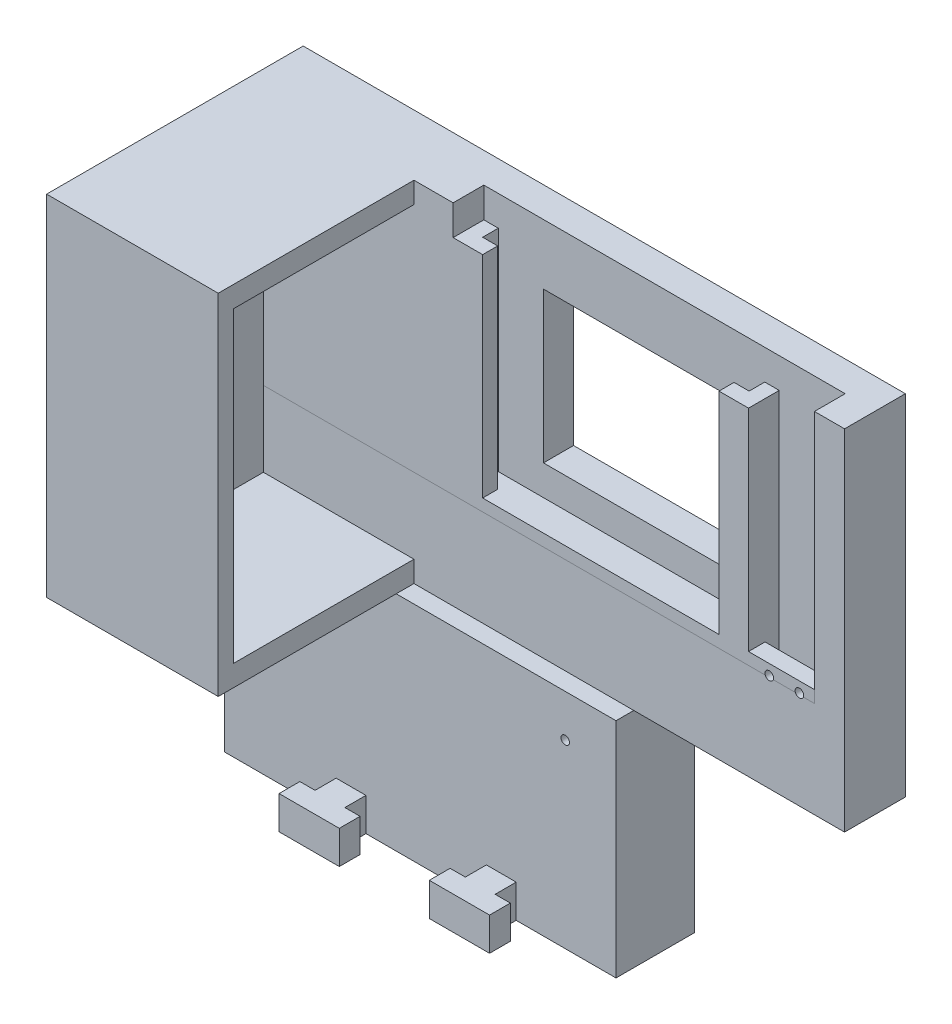
from build123d import *

# Parameters (mm, degrees)
SKETCH1_W            = 190
SKETCH1_H            = 80
BOSS_EXTRUDE1_DEPTH  = 10
BOSS_EXTRUDE2_DEPTH  = 70
SKETCH3_W            = 58.5
SKETCH3_H            = 50
CUT_EXTRUDE1_DEPTH   = 10
SKETCH5_W            = 190
SKETCH5_H            = 20.2
BOSS_EXTRUDE3_DEPTH  = 4
BOSS_EXTRUDE5_DEPTH  = 20.1999
SKETCH7_W            = 200
SKETCH7_H            = 74
SKETCH7_W_2          = 0.268020534
SKETCH7_H_2          = 19.603817147
BOSS_EXTRUDE6_DEPTH  = 5.9
BOSS_EXTRUDE7_DEPTH  = 11
SKETCH21_W           = 21.9
SKETCH21_H           = 4.7
CUT_EXTRUDE7_DEPTH   = 5.5
SKETCH22_R           = 1.425
CUT_EXTRUDE8_DEPTH   = 5.5
SKETCH23_W           = 70
SKETCH23_H           = 80
BOSS_EXTRUDE8_DEPTH  = 10.2
SKETCH24_W           = 70
SKETCH24_H           = 74
CUT_EXTRUDE9_DEPTH   = 185.949195132
BOSS_EXTRUDE10_DEPTH = 60
SKETCH26_W           = 57
SKETCH26_H           = 116
BOSS_EXTRUDE11_DEPTH = 5
SKETCH27_R           = 1.4
CUT_EXTRUDE10_DEPTH  = 10
SKETCH28_R           = 1.4
CUT_EXTRUDE11_DEPTH  = 10


with BuildPart() as part:
    # Sketch1 → Boss-Extrude1 (new body)
    with BuildSketch(Plane.XY):
        Rectangle(SKETCH1_W, SKETCH1_H)
    extrude(amount=BOSS_EXTRUDE1_DEPTH)

    # Sketch2 → Boss-Extrude2 (add)
    with BuildSketch(Plane.XZ.offset(40)):
        Polygon((-25, 10), (-20.2, 10), (-20.2, 15.2), (-15.2, 15.2), (-15.2, 20.2), (-25, 20.2), align=None)
        Polygon((68.3, 10), (73.1, 10), (73.1, 20.2), (63.3, 20.2), (63.3, 15.2), (68.3, 15.2), align=None)
    extrude(amount=-BOSS_EXTRUDE2_DEPTH)

    # Sketch3 → Cut-Extrude1 (cut)
    with BuildSketch(Plane.XY.offset(10)):
        with Locations((24.05, -5)):
            Rectangle(SKETCH3_W, SKETCH3_H)
    extrude(amount=-CUT_EXTRUDE1_DEPTH, mode=Mode.SUBTRACT)

    # Sketch5 → Boss-Extrude3 (add)
    with BuildSketch(Plane(origin=(0, -40, 0), x_dir=(-1, 0, 0), z_dir=(0, -1, 0))):
        with Locations((0, -10.1)):
            Rectangle(SKETCH5_W, SKETCH5_H)
    extrude(amount=BOSS_EXTRUDE3_DEPTH)

    # Sketch6 → Boss-Extrude5 (add)
    with BuildSketch(Plane(origin=(0, 0, 0), x_dir=(-1, 0, 0), z_dir=(0, 0, -1))):
        Polygon((95, -150), (95, -44), (-95, -44), (-95, 40), (-105, 40), (-105, -150), align=None)
    extrude(amount=-BOSS_EXTRUDE5_DEPTH)

    # Sketch7 → Boss-Extrude6 (add)
    with BuildSketch(Plane.XY.offset(20.1999)):
        with Locations((5, -113)):
            Rectangle(SKETCH7_W, SKETCH7_H)
        with Locations((70.627340548, -99.185279167)):
            Rectangle(SKETCH7_W_2, SKETCH7_H_2, mode=Mode.SUBTRACT)
    extrude(amount=BOSS_EXTRUDE6_DEPTH)

    # Sketch8 → Boss-Extrude7 (add)
    with BuildSketch(Plane.XZ.offset(150)):
        Polygon((-63, 33.0999), (-57.95, 33.0999), (-57.95, 26.0999), (-48.05, 26.0999), (-48.05, 33.0999), (-43, 33.0999), (-43, 39.9999), (-63, 39.9999), align=None)
        Polygon((-8.05, 33.0999), (-8.05, 26.0999), (1.85, 26.0999), (1.85, 33.0999), (6.9, 33.0999), (6.9, 39.9999), (-13.1, 39.9999), (-13.1, 33.0999), align=None)
    extrude(amount=-BOSS_EXTRUDE7_DEPTH)

    # Sketch21 → Cut-Extrude7 (cut)
    with BuildSketch(Plane(origin=(0, -40, 0), x_dir=(1, 0, 0), z_dir=(0, 1, 0))):
        with Locations((84.05, -12.35)):
            Rectangle(SKETCH21_W, SKETCH21_H)
    extrude(amount=-CUT_EXTRUDE7_DEPTH, mode=Mode.SUBTRACT)

    # Sketch22 → Cut-Extrude8 (cut)
    with BuildSketch(Plane.XY.offset(20.2)):
        with Locations((90, -43.5)):
            Circle(SKETCH22_R)
        with Locations((80, -43.5)):
            Circle(SKETCH22_R)
    extrude(amount=-CUT_EXTRUDE8_DEPTH, mode=Mode.SUBTRACT)

    # Sketch23 → Boss-Extrude8 (add)
    with BuildSketch(Plane.XY.offset(10)):
        with Locations((-60, 0)):
            Rectangle(SKETCH23_W, SKETCH23_H)
    extrude(amount=BOSS_EXTRUDE8_DEPTH)

    # Sketch24 → Cut-Extrude9 (cut, through all)
    with BuildSketch(Plane.XY.offset(26.0999)):
        with Locations((70, -113)):
            Rectangle(SKETCH24_W, SKETCH24_H)
    extrude(amount=-CUT_EXTRUDE9_DEPTH, mode=Mode.SUBTRACT)

    # Sketch25 → Boss-Extrude10 (add)
    with BuildSketch(Plane.XY.offset(20.2)):
        Polygon((-38, 33), (-38, 40), (-95, 40), (-95, -76), (-38, -76), (-38, -69), (-88, -69), (-88, 33), align=None)
    extrude(amount=BOSS_EXTRUDE10_DEPTH)

    # Sketch26 → Boss-Extrude11 (add)
    with BuildSketch(Plane.XY.offset(80.2)):
        with Locations((-66.5, -18)):
            Rectangle(SKETCH26_W, SKETCH26_H)
    extrude(amount=BOSS_EXTRUDE11_DEPTH)

    # Sketch27 → Cut-Extrude10 (cut)
    with BuildSketch(Plane(origin=(0, -150, 0), x_dir=(-1, 0, 0), z_dir=(0, -1, 0))):
        with Locations((-18.5, -16.0999)):
            Circle(SKETCH27_R)
        with Locations((74.6, -16.0999)):
            Circle(SKETCH27_R)
    extrude(amount=-CUT_EXTRUDE10_DEPTH, mode=Mode.SUBTRACT)

    # Sketch28 → Cut-Extrude11 (cut)
    with BuildSketch(Plane.XY.offset(26.0999)):
        with Locations((18.14, -90)):
            Circle(SKETCH28_R)
        with Locations((-78.14, -90)):
            Circle(SKETCH28_R)
    extrude(amount=-CUT_EXTRUDE11_DEPTH, mode=Mode.SUBTRACT)


with BuildPart() as body_2:
    # Split1: the piece on the far side of the plane
    add(part.part)
    split(bisect_by=Plane(origin=(105, -76, 26.0999), x_dir=(-1, 0, 0), z_dir=(0, -1, 0)), keep=Keep.BOTTOM)


with BuildPart() as part_1:
    add(part.part)

    # Split1
    split(bisect_by=Plane(origin=(105, -76, 26.0999), x_dir=(-1, 0, 0), z_dir=(0, -1, 0)), keep=Keep.TOP)


solid = Compound([body_2.part, part_1.part])
